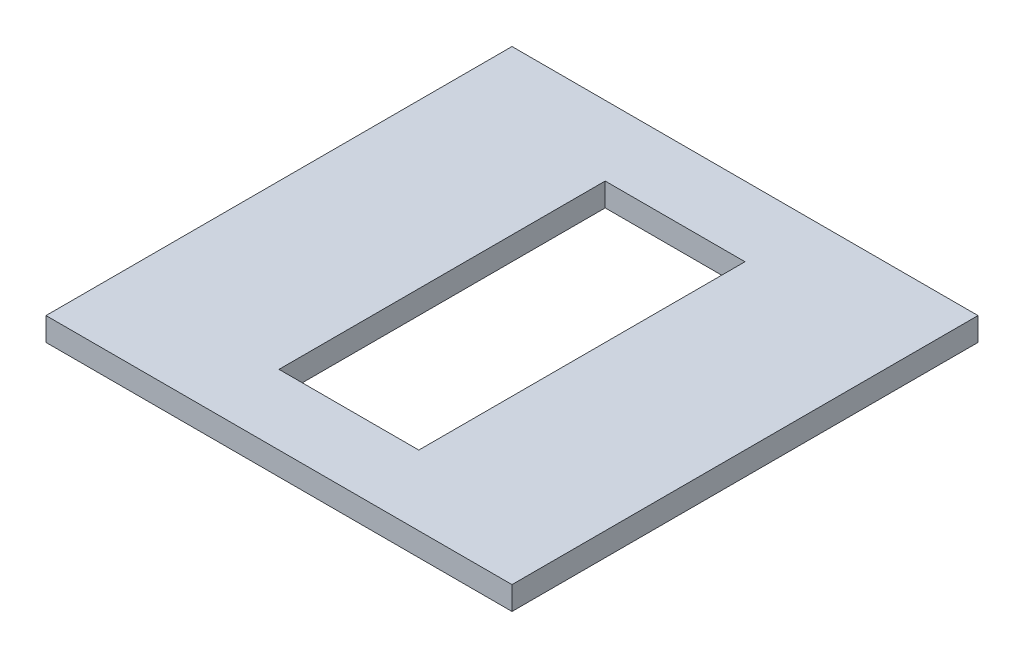
from build123d import *

# Parameters (mm, degrees)
SKETCH1_W           = 100
SKETCH1_H           = 100
SKETCH1_W_2         = 30
SKETCH1_H_2         = 70
BOSS_EXTRUDE1_DEPTH = 5


with BuildPart() as part:
    # Sketch1 → Boss-Extrude1 (new body)
    with BuildSketch(Plane(origin=(0, 0, 0), x_dir=(1, 0, 0), z_dir=(0, 1, 0))):
        with Locations((0.697674419, -9.418604651)):
            Rectangle(SKETCH1_W, SKETCH1_H)
        with Locations((0.697674419, -9.418604651)):
            Rectangle(SKETCH1_W_2, SKETCH1_H_2, mode=Mode.SUBTRACT)
    extrude(amount=BOSS_EXTRUDE1_DEPTH)


solid = part.part
